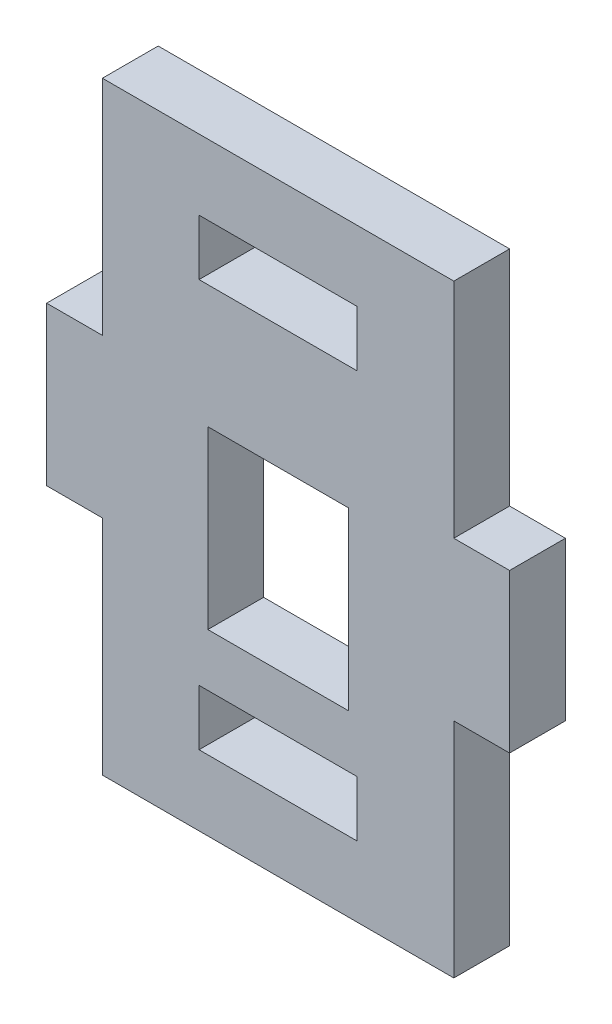
from build123d import *

# Parameters (mm, degrees)
BOSS_EXTRUDE1_DEPTH = 1.5875


with BuildPart() as part:
    # Sketch2 → Boss-Extrude1 (new, symmetric)
    with BuildSketch(Plane.XY):
        Polygon((0, 12.675), (0, 0), (20, 0), (20, 12.675), (23.175, 12.675), (23.175, 21.675), (20, 21.675), (20, 27.175), (20, 34.35), (0, 34.35), (0, 21.675), (-3.175, 21.675), (-3.175, 12.675), align=None)
        Polygon((14.5, 7.175), (14.5, 4), (10, 4), (5.5, 4), (5.5, 7.175), align=None, mode=Mode.SUBTRACT)
        Polygon((14, 10.175), (10, 10.175), (6, 10.175), (6, 20.175), (14, 20.175), align=None, mode=Mode.SUBTRACT)
        Polygon((14.5, 30.35), (14.5, 27.175), (5.5, 27.175), (5.5, 30.35), (10, 30.35), align=None, mode=Mode.SUBTRACT)
    extrude(amount=BOSS_EXTRUDE1_DEPTH, both=True)


solid = part.part
